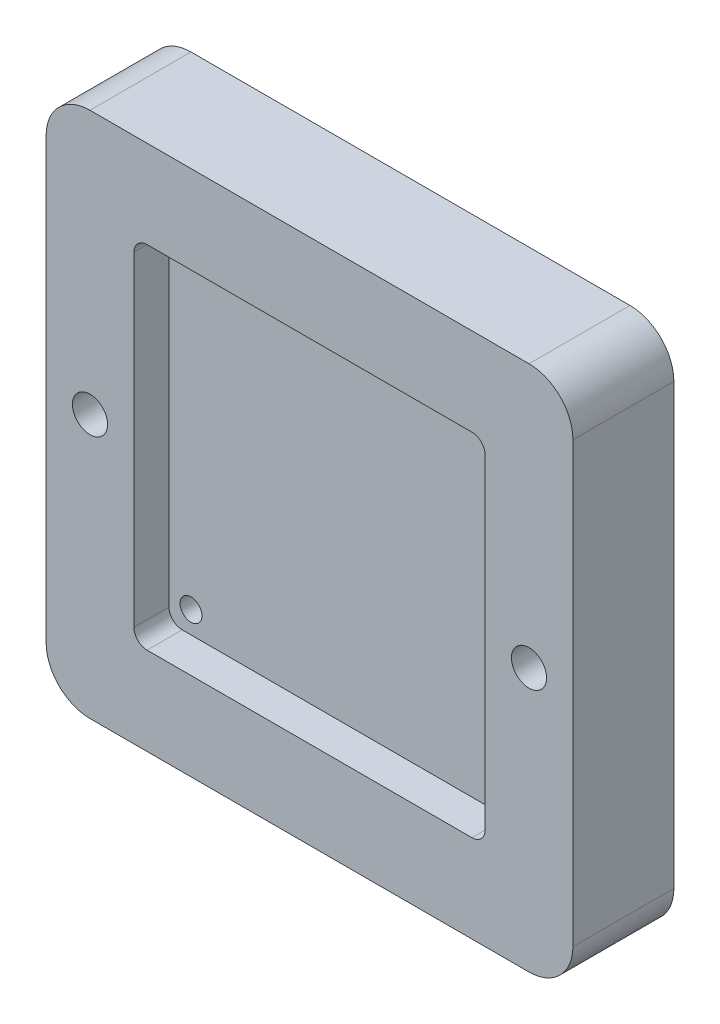
from build123d import *

# Parameters (mm, degrees)
BOSS_EXTRUDE1_DEPTH             = 8
BOSS_EXTRUDE2_DEPTH             = 15
F_8_0MM_DOWEL_HOLE1_D           = 8
F_8_0MM_DOWEL_HOLE1_DEPTH       = 18
F_8_0MM_DOWEL_HOLE1_TIP         = 2.403442476
TAP_DRILL_FOR_M6X1_0_TAP1_D     = 5
TAP_DRILL_FOR_M6X1_0_TAP1_DEPTH = 10
TAP_DRILL_FOR_M6X1_0_TAP1_TIP   = 1.502151548


with BuildPart() as part:
    # Sketch1 → Boss-Extrude1 (new body)
    with BuildSketch(Plane.XY):
        with BuildLine():
            Line((-50, 60), (50, 60))
            ThreePointArc((50, 60), (57.071067812, 57.071067812), (60, 50))
            Line((60, 50), (60, -50))
            ThreePointArc((60, -50), (57.071067812, -57.071067812), (50, -60))
            Line((50, -60), (-50, -60))
            ThreePointArc((-50, -60), (-57.071067812, -57.071067812), (-60, -50))
            Line((-60, -50), (-60, 50))
            ThreePointArc((-60, 50), (-57.071067812, 57.071067812), (-50, 60))
        make_face()
        with BuildLine():
            Line((-37, 40), (37, 40))
            ThreePointArc((37, 40), (39.121320344, 39.121320344), (40, 37))
            Line((40, 37), (40, -37))
            ThreePointArc((40, -37), (39.121320344, -39.121320344), (37, -40))
            Line((37, -40), (-37, -40))
            ThreePointArc((-37, -40), (-39.121320344, -39.121320344), (-40, -37))
            Line((-40, -37), (-40, 37))
            ThreePointArc((-40, 37), (-39.121320344, 39.121320344), (-37, 40))
        make_face(mode=Mode.SUBTRACT)
    extrude(amount=-BOSS_EXTRUDE1_DEPTH)

    # Sketch2 → Boss-Extrude2 (add)
    with BuildSketch(Plane.XY.offset(-8)):
        with BuildLine():
            Line((-50, -60), (50, -60))
            ThreePointArc((50, -60), (57.071067812, -57.071067812), (60, -50))
            Line((60, -50), (60, 50))
            ThreePointArc((60, 50), (57.071067812, 57.071067812), (50, 60))
            Line((50, 60), (-50, 60))
            ThreePointArc((-50, 60), (-57.071067812, 57.071067812), (-60, 50))
            Line((-60, 50), (-60, -50))
            ThreePointArc((-60, -50), (-57.071067812, -57.071067812), (-50, -60))
        make_face()
    extrude(amount=-BOSS_EXTRUDE2_DEPTH)

    # Ø8.0mm Dowel Hole1
    with Locations(Plane.XY):
        with Locations((-50, 0), (50, 0)):
            Hole(F_8_0MM_DOWEL_HOLE1_D / 2, depth=F_8_0MM_DOWEL_HOLE1_DEPTH)
            with Locations((0, 0, -(F_8_0MM_DOWEL_HOLE1_DEPTH + F_8_0MM_DOWEL_HOLE1_TIP / 2))):  # 118° drill point
                Cone(0, F_8_0MM_DOWEL_HOLE1_D / 2, F_8_0MM_DOWEL_HOLE1_TIP, mode=Mode.SUBTRACT)

    # Tap Drill for M6x1.0 Tap1
    with Locations(Plane.XY.offset(-8)):
        with Locations((-35, 35), (35, 35), (35, -35), (-35, -35)):
            Hole(TAP_DRILL_FOR_M6X1_0_TAP1_D / 2, depth=TAP_DRILL_FOR_M6X1_0_TAP1_DEPTH)
            with Locations((0, 0, -(TAP_DRILL_FOR_M6X1_0_TAP1_DEPTH + TAP_DRILL_FOR_M6X1_0_TAP1_TIP / 2))):  # 118° drill point
                Cone(0, TAP_DRILL_FOR_M6X1_0_TAP1_D / 2, TAP_DRILL_FOR_M6X1_0_TAP1_TIP, mode=Mode.SUBTRACT)


solid = part.part
